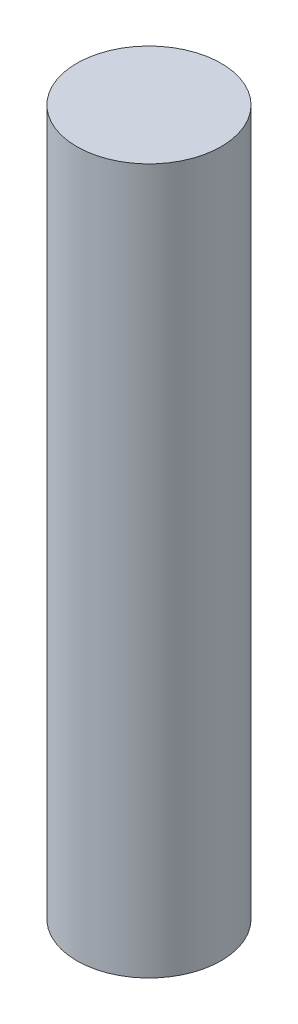
from build123d import *

# Parameters (mm, degrees)
SKETCH1_R           = 3.175
BOSS_EXTRUDE1_DEPTH = 31


with BuildPart() as part:
    # Sketch1 → Boss-Extrude1 (new body)
    with BuildSketch(Plane(origin=(0, 0, 0), x_dir=(1, 0, 0), z_dir=(0, 1, 0))):
        Circle(SKETCH1_R)
    extrude(amount=BOSS_EXTRUDE1_DEPTH)


solid = part.part
